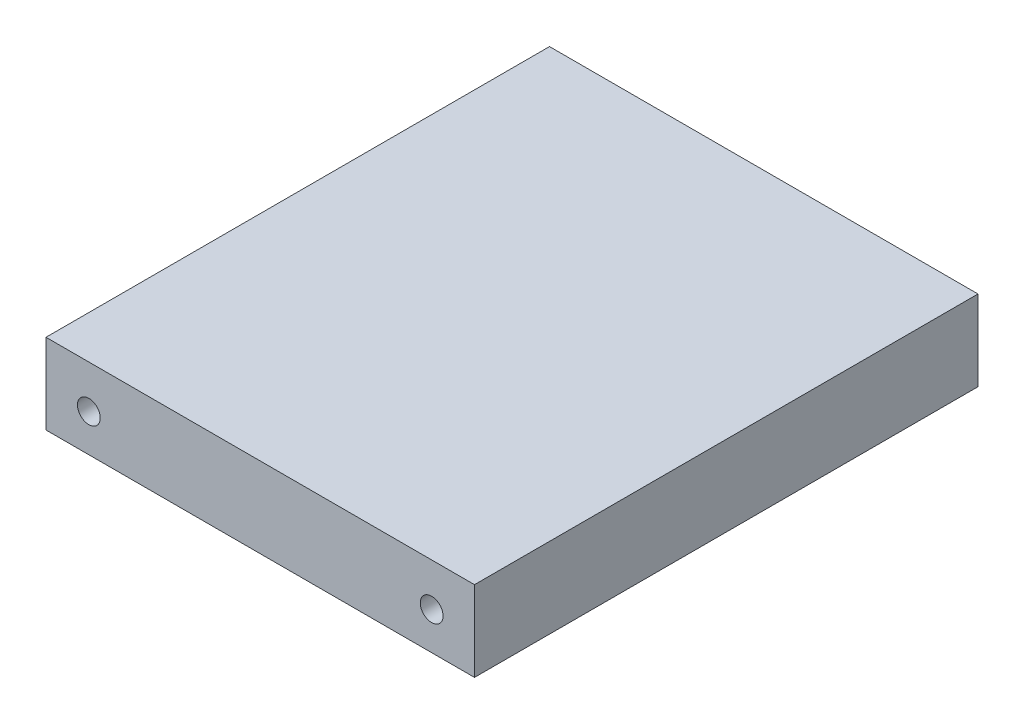
from build123d import *

# Parameters (mm, degrees)
SKETCH2_W                 = 50.8
SKETCH2_H                 = 59.69
BOSS_EXTRUDE1_DEPTH       = 9.525
F_6_32_TAPPED_HOLE1_D     = 2.7051
F_6_32_TAPPED_HOLE1_DEPTH = 9.398
F_6_32_TAPPED_HOLE1_TIP   = 0.81269403
F_6_32_TAPPED_HOLE2_D     = 2.7051
F_6_32_TAPPED_HOLE2_DEPTH = 9.398
F_6_32_TAPPED_HOLE2_TIP   = 0.81269403


with BuildPart() as part:
    # Sketch2 → Boss-Extrude1 (new body)
    with BuildSketch(Plane(origin=(0, 0, 0), x_dir=(1, 0, 0), z_dir=(0, 1, 0))):
        Rectangle(SKETCH2_W, SKETCH2_H)
    extrude(amount=BOSS_EXTRUDE1_DEPTH)

    # #6-32 Tapped Hole1
    with Locations(Plane.XY.offset(29.845)):
        with Locations((-20.32, 4.445), (20.32, 4.445)):
            Hole(F_6_32_TAPPED_HOLE1_D / 2, depth=F_6_32_TAPPED_HOLE1_DEPTH)
            with Locations((0, 0, -(F_6_32_TAPPED_HOLE1_DEPTH + F_6_32_TAPPED_HOLE1_TIP / 2))):  # 118° drill point
                Cone(0, F_6_32_TAPPED_HOLE1_D / 2, F_6_32_TAPPED_HOLE1_TIP, mode=Mode.SUBTRACT)

    # #6-32 Tapped Hole2
    with Locations(Plane(origin=(0, 0, -29.845), x_dir=(-1, 0, 0), z_dir=(0, 0, -1))):
        with Locations((-20.32, 4.445), (20.32, 4.445)):
            Hole(F_6_32_TAPPED_HOLE2_D / 2, depth=F_6_32_TAPPED_HOLE2_DEPTH)
            with Locations((0, 0, -(F_6_32_TAPPED_HOLE2_DEPTH + F_6_32_TAPPED_HOLE2_TIP / 2))):  # 118° drill point
                Cone(0, F_6_32_TAPPED_HOLE2_D / 2, F_6_32_TAPPED_HOLE2_TIP, mode=Mode.SUBTRACT)


solid = part.part
